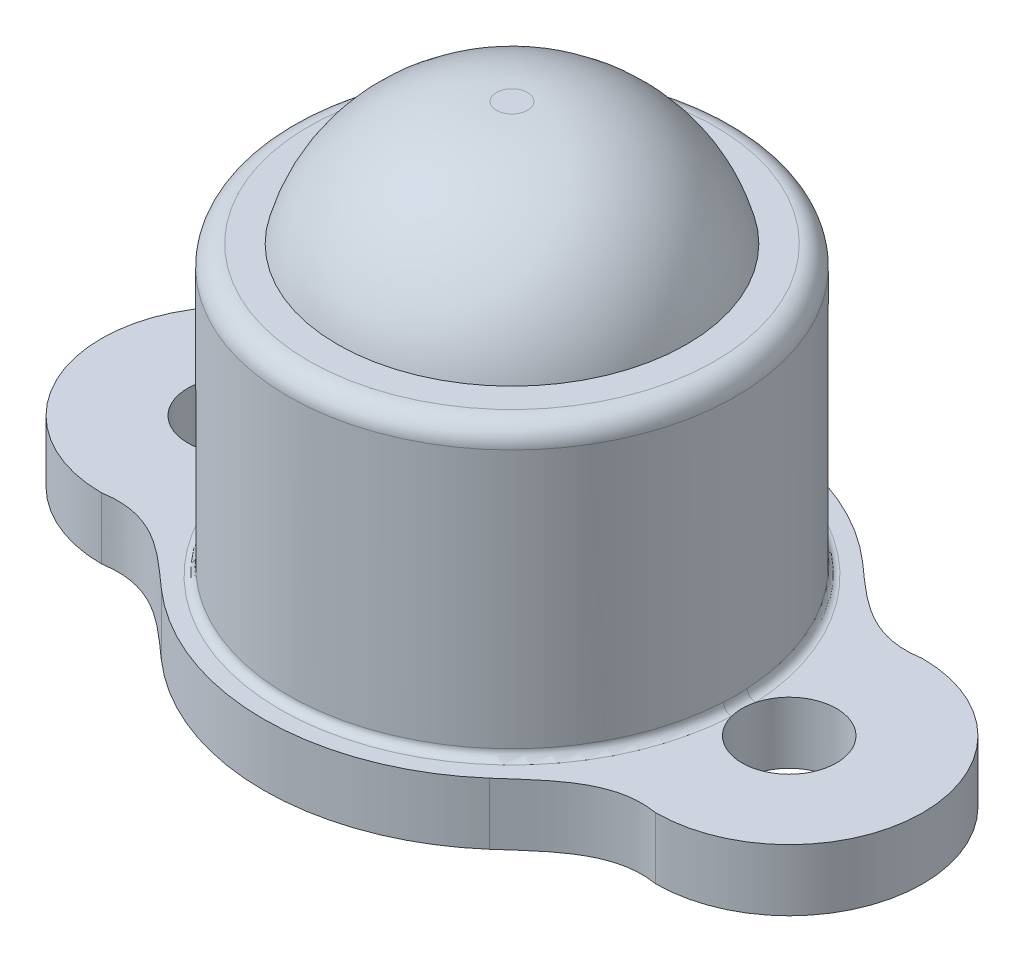
from build123d import *

# Parameters (mm, degrees)
BOSS_EXTRUDE1_OUTLINE_R = 2.946896199
BOSS_EXTRUDE1_DEPTH     = 1.5
SKETCH2_R               = 1.15
CUT_EXTRUDE1_DEPTH      = 12.783569218
SKETCH3_R               = 5.446896199
SKETCH3_R_2             = 2.946896199
BOSS_EXTRUDE2_DEPTH     = 7
SKETCH4_R               = 4.25
BOSS_EXTRUDE3_DEPTH     = 3
FILLET1_R               = 4
FILLET2_R               = 0.5
FILLET3_R               = 0.2


# Read off the part's stored shape, not the designer's step: Boss-Extrude1
with BuildPart() as part:
    # Boss-Extrude1 outline → Boss-Extrude1 (new body)
    with BuildSketch(Plane(origin=(0, 0, 0), x_dir=(1, 0, 0), z_dir=(0, 1, 0))):
        with BuildLine():
            ThreePointArc((-6.75, 3.25), (-10, 0), (-6.75, -3.25))
            add(Edge.make_bspline(
                [(-6.75, -3.25), (-5.557172284, -3.046535522), (-4.778196117, -3.855368441), (-3.992313535, -4.545759853)],
                knots=[0, 0, 0, 0, 1, 1, 1, 1], degree=3))
            ThreePointArc((-3.992313535, -4.545759853), (0, -6.05), (3.992313535, -4.545759853))
            add(Edge.make_bspline(
                [(6.75, -3.25), (5.557172284, -3.046535522), (4.778196117, -3.855368441), (3.992313535, -4.545759853)],
                knots=[0, 0, 0, 0, 1, 1, 1, 1], degree=3))
            ThreePointArc((6.75, -3.25), (10, 0), (6.75, 3.25))
            add(Edge.make_bspline(
                [(6.75, 3.25), (5.557172284, 3.046535522), (4.778196117, 3.855368441), (3.992313535, 4.545759853)],
                knots=[0, 0, 0, 0, 1, 1, 1, 1], degree=3))
            ThreePointArc((3.992313535, 4.545759853), (0, 6.05), (-3.992313535, 4.545759853))
            add(Edge.make_bspline(
                [(-6.75, 3.25), (-5.557172284, 3.046535522), (-4.778196117, 3.855368441), (-3.992313535, 4.545759853)],
                knots=[0, 0, 0, 0, 1, 1, 1, 1], degree=3))
        make_face()
        Circle(BOSS_EXTRUDE1_OUTLINE_R, mode=Mode.SUBTRACT)
    extrude(amount=BOSS_EXTRUDE1_DEPTH)

    # Sketch2 → Cut-Extrude1 (cut, through all)
    with BuildSketch(Plane(origin=(0, 1.5, 0), x_dir=(1, 0, 0), z_dir=(0, 1, 0))):
        with Locations(Location((-6.75, 0, 0), (0, 0, 270))):
            Circle(SKETCH2_R)
        with Locations(Location((6.75, 0, 0), (0, 0, 90))):
            Circle(SKETCH2_R)
    extrude(amount=-CUT_EXTRUDE1_DEPTH, mode=Mode.SUBTRACT)

    # Sketch3 → Boss-Extrude2 (add)
    with BuildSketch(Plane(origin=(0, 1.5, 0), x_dir=(1, 0, 0), z_dir=(0, 1, 0))):
        with Locations(Location((0, 0, 0), (0, 0, 270))):
            Circle(SKETCH3_R)
        with Locations(Location((0, 0, 0), (0, 0, 270))):
            Circle(SKETCH3_R_2, mode=Mode.SUBTRACT)
    extrude(amount=BOSS_EXTRUDE2_DEPTH)

    # Sketch4 → Boss-Extrude3 (add)
    with BuildSketch(Plane(origin=(0, 8.5, 0), x_dir=(1, 0, 0), z_dir=(0, 1, 0))):
        with Locations(Location((0, 0, 0), (0, 0, 270))):
            Circle(SKETCH4_R)
    extrude(amount=BOSS_EXTRUDE3_DEPTH)

    # Fillet1
    # the kernel refuses this fillet: 4 mm, written as the material it takes off along each edge
    with BuildSketch(Plane(origin=(0, 11.5, 0), x_dir=(0, 0, 1), z_dir=(-1, 0, 0))) as fillet1_piece_1:
        with BuildLine():
            CenterArc((0.377016654, -4), FILLET1_R, 14.477512186, 75.522487814)
            Line((0.377016654, 0), (0.377016654, 0.08))
            Line((0.377016654, 0.08), (4.25, 0.08))
            Line((4.25, 0.08), (4.33, 0))
            ThreePointArc((4.33, 0), (4.33, -1.5), (4.327459667, -2.98))
            Line((4.327459667, -2.98), (4.25, -3))
        make_face()
    revolve(axis=Axis((0, 11.5, 0), (0, 1, 0)), mode=Mode.SUBTRACT)

    # Fillet2
    fillet2_edges = [part.edges().sort_by_distance(p)[0] for p in [
        (0, 8.5, -5.446896199),
    ]]
    fillet(fillet2_edges, radius=FILLET2_R)

    # Fillet3
    fillet3_edges = [part.edges().sort_by_distance(p)[0] for p in [
        (0, 1.5, -5.446896199),
    ]]
    fillet(fillet3_edges, radius=FILLET3_R)


solid = part.part
